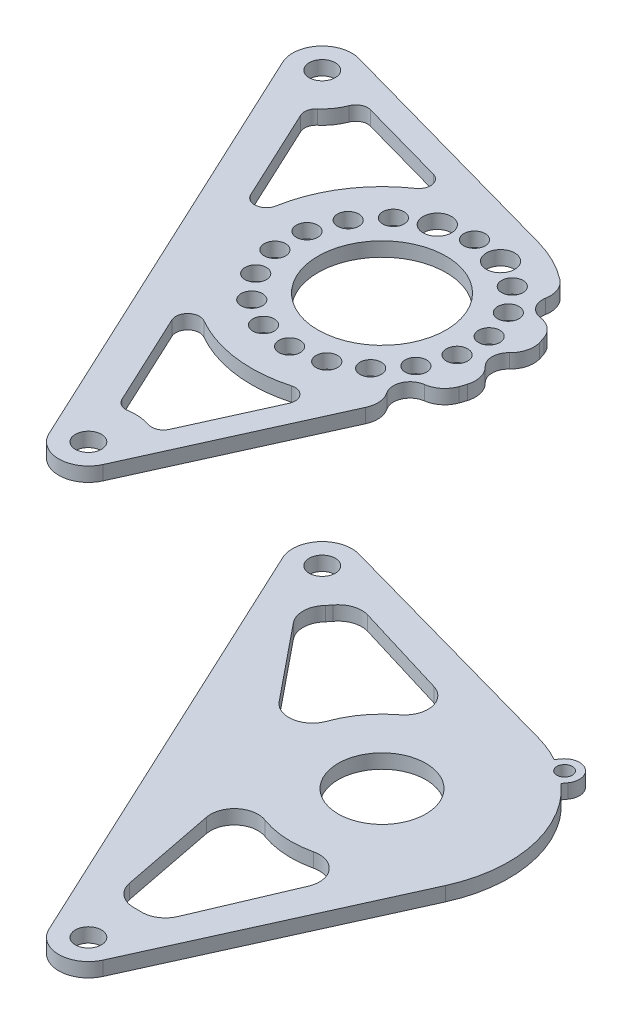
from build123d import *

# Parameters (mm, degrees)
SKETCH1_R            = 27
SKETCH1_R_2          = 5.500000000000008
SKETCH1_R_3          = 5.500000000000017
BOSS_EXTRUDE1_DEPTH  = 6
M8_CLEARANCE_HOLE1_D = 9
SKETCH4_R            = 5.999999999999999
CUT_EXTRUDE1_DEPTH   = 168.21175155495473
BOSS_EXTRUDE3_DEPTH  = 6
SKETCH9_R            = 18.5
SKETCH9_R_2          = 5.500000000000017
SKETCH9_R_3          = 5.500000000000006
BOSS_EXTRUDE2_DEPTH  = 6
SKETCH7_R            = 7.059999999999994
SKETCH7_R_2          = 7.0600000000000005
SKETCH7_R_3          = 7.059999999999993
CUT_EXTRUDE4_DEPTH   = 6
FILLET1_R            = 10
CUT_EXTRUDE5_DEPTH   = 6
FILLET2_R            = 5
CUT_EXTRUDE6_DEPTH   = 6
FILLET3_R            = 10
BOSS_EXTRUDE4_DEPTH  = 6
SKETCH19_R           = 3.2500000000000013
CUT_EXTRUDE7_DEPTH   = 6


with BuildPart() as part:
    # Sketch1 → Boss-Extrude1 (new body)
    with BuildSketch(Plane(origin=(0, 0, 0), x_dir=(1, 0, 0), z_dir=(0, 1, 0))):
        with BuildLine():
            Line((43.10169024537115, -16.069981269188727), (4.121656155384393, -120.61928515182078))
            ThreePointArc((4.121656155384393, -120.61928515182078), (-7.090354785618229, -128.74242219741816), (-18.916285003056604, -121.542288914277))
            Line((-18.916285003056604, -121.542288914277), (-105.34584466052408, 63.502809745719105))
            ThreePointArc((-105.34584466052408, 63.502809745719105), (-103.27710977103428, 77.19276521532294), (-89.85172700954884, 80.57708826585134))
            Line((-89.85172700954884, 80.57708826585134), (15.340419737897069, 43.366709839059006))
            ThreePointArc((15.340419737897069, 43.366709839059006), (41.67793321769229, 19.46663511502645), (43.10169024537115, -16.069981269188727))
        make_face()
        with Locations(Location((0, 0, 0), (0, 0, 270))):
            Circle(SKETCH1_R, mode=Mode.SUBTRACT)
        with Locations(Location((-7.590759672162107, -116.25244241562818, 0), (0, 0, 270))):
            Circle(SKETCH1_R_2, mode=Mode.SUBTRACT)
        with Locations(Location((-94.02031932962956, 68.79265624436792, 0), (0, 0, 270))):
            Circle(SKETCH1_R_3, mode=Mode.SUBTRACT)
    extrude(amount=BOSS_EXTRUDE1_DEPTH)

    # M8 Clearance Hole1 (through all)
    with Locations(Plane(origin=(0, 6, 0), x_dir=(1, 0, 0), z_dir=(0, 1, 0))):
        with Locations((0, 39), (25.068716778, 29.875733282), (33.774990748, 19.5), (38.407502367, 6.772278929), (38.407502367, -6.772278929), (33.774990748, -19.5), (25.068716778, -29.875733282), (13.33878559, -36.648012211), (0, -39), (-13.33878559, -36.648012211), (-25.068716778, -29.875733282), (-33.774990748, -19.5), (-38.407502367, -6.772278929), (-38.407502367, 6.772278929), (-33.774990748, 19.5), (-25.068716778, 29.875733282)):
            Hole(M8_CLEARANCE_HOLE1_D / 2)

    # Sketch4 → Cut-Extrude1 (cut, through all)
    with BuildSketch(Plane(origin=(0, 6, 0), x_dir=(1, 0, 0), z_dir=(0, 1, 0))):
        with Locations(Location((-13.335, 36.64938983121001, 0), (0, 0, 270))):
            Circle(SKETCH4_R)
        with Locations(Location((13.335, 36.64938983121001, 0), (0, 0, 270))):
            Circle(SKETCH4_R)
    extrude(amount=-CUT_EXTRUDE1_DEPTH, mode=Mode.SUBTRACT)

    # Sketch13 → Boss-Extrude3 (add)
    with BuildSketch(Plane.XZ):
        with BuildLine():
            Line((48.74417686435453, 22.051195473636422), (3.798066698014179, 121.40459089077687))
            Line((3.798066698014179, 121.40459089077687), (43.10169024537115, 16.069981269188727))
            ThreePointArc((43.10169024537115, 16.069981269188727), (41.67793321769229, -19.46663511502645), (15.340419737897069, -43.366709839059006))
            Line((15.340419737897069, -43.366709839059006), (-90.66162764448717, -80.83297144639462))
            Line((-90.66162764448717, -80.83297144639462), (14.37520041240948, -51.53254906467429))
            ThreePointArc((14.37520041240948, -51.53254906467429), (48.473248416229154, -22.640543014215424), (48.74417686435453, 22.051195473636422))
        make_face()
    extrude(amount=-BOSS_EXTRUDE3_DEPTH)

    # Sketch7 → Cut-Extrude4 (cut)
    with BuildSketch(Plane(origin=(0, 6, 0), x_dir=(1, 0, 0), z_dir=(0, 1, 0))):
        with Locations((43.28713896759637, 31.44)):
            Circle(SKETCH7_R)
        with Locations((53.5, 0)):
            Circle(SKETCH7_R_2)
        with Locations((43.28713896759637, -31.44)):
            Circle(SKETCH7_R_3)
    extrude(amount=-CUT_EXTRUDE4_DEPTH, mode=Mode.SUBTRACT)

    # Fillet1
    fillet1_edges = [part.edges().sort_by_distance(p)[0] for p in [
        (47.050098611701245, 3, -25.46641358003106),
        (38.77037136127814, 3, -36.866086102386646),
        (53.034171962616824, 3, 7.0446152655477015),
        (53.034171962616824, 3, -7.044615265547705),
        (47.16556143663344, 3, 25.54072554023223),
        (41.41704833354494, 3, 38.24781617116921),
    ]]
    fillet(fillet1_edges, radius=FILLET1_R)

    # Sketch14 → Cut-Extrude5 (cut)
    with BuildSketch(Plane(origin=(0, 6, 0), x_dir=(1, 0, 0), z_dir=(0, 1, 0))):
        with BuildLine():
            Line((-74.23517315376525, 65.86896152711691), (-20.730399437587575, 50.943601552678516))
            ThreePointArc((-20.730399437587575, 50.943601552678516), (-49.25962394873262, 24.46404399173302), (-53.116964372688535, -14.268430040846713))
            Line((-53.116964372688535, -14.268430040846713), (-83.86494519848478, 51.56278752007186))
            ThreePointArc((-83.86494519848478, 51.56278752007186), (-77.42889555879034, 57.62463684715917), (-74.23517315376525, 65.86896152711691))
        make_face()
        with BuildLine():
            Line((-14.285548146168242, -97.40622774826556), (-45.0335289719607, -31.575010187355062))
            ThreePointArc((-45.0335289719607, -31.575010187355062), (-12.85572984750795, -53.47644537633268), (25.76091414072229, -48.5939842226827))
            Line((25.76091414072229, -48.5939842226827), (2.865787751627601, -99.20367073042938))
            ThreePointArc((2.865787751627601, -99.20367073042938), (-5.506195468880833, -96.36137426727582), (-14.285548146168242, -97.40622774826556))
        make_face()
    extrude(amount=-CUT_EXTRUDE5_DEPTH, mode=Mode.SUBTRACT)

    # Fillet2
    fillet2_edges = [part.edges().sort_by_distance(p)[0] for p in [
        (-74.23517315376525, 3, -65.86896152711691),
        (-20.730399437587575, 3, -50.943601552678516),
        (-53.116964372688535, 3, 14.268430040846713),
        (-83.86494519848478, 3, -51.56278752007185),
        (-14.285548146168242, 3, 97.40622774826556),
        (-45.033528971960706, 3, 31.575010187355062),
        (25.76091414072229, 3, 48.5939842226827),
        (2.865787751627601, 3, 99.20367073042938),
    ]]
    fillet(fillet2_edges, radius=FILLET2_R)


with BuildPart() as body_2:
    # Sketch9 → Boss-Extrude2 (new body)
    with BuildSketch(Plane(origin=(0, -175, 0), x_dir=(1, 0, 0), z_dir=(0, 1, 0))):
        with BuildLine():
            Line((-90.66162764448717, 80.83297144639464), (14.375200412409482, 51.53254906467428))
            ThreePointArc((14.375200412409482, 51.53254906467428), (48.47324841622914, 22.640543014215417), (48.74417686435452, -22.051195473636422))
            Line((48.74417686435452, -22.051195473636422), (3.7980666980141717, -121.40459089077687))
            ThreePointArc((3.7980666980141717, -121.40459089077687), (-7.514984070465397, -128.75221273584555), (-18.916285003056604, -121.542288914277))
            Line((-18.916285003056604, -121.542288914277), (-105.34584466052408, 63.502809745719105))
            ThreePointArc((-105.34584466052408, 63.502809745719105), (-103.55715505893005, 76.87342132400846), (-90.66162764448717, 80.83297144639464))
        make_face()
        with Locations(Location((0, 0, 0), (0, 0, 270))):
            Circle(SKETCH9_R, mode=Mode.SUBTRACT)
        with Locations(Location((-94.02031932962956, 68.79265624436792, 0), (0, 0, 270))):
            Circle(SKETCH9_R_2, mode=Mode.SUBTRACT)
        with Locations(Location((-7.590759672162106, -116.25244241562818, 0), (0, 0, 270))):
            Circle(SKETCH9_R_3, mode=Mode.SUBTRACT)
    extrude(amount=-BOSS_EXTRUDE2_DEPTH)

    # Sketch15 → Cut-Extrude6 (cut)
    with BuildSketch(Plane.XZ.offset(181)):
        with BuildLine():
            Line((11.188628918305138, -36.83835749498702), (-74.40509001411698, -62.83507461254312))
            ThreePointArc((-74.40509001411698, -62.83507461254312), (-78.71449045511118, -55.15514905045745), (-85.84840137943056, -49.991864851045776))
            Line((-85.84840137943056, -49.991864851045776), (-37.181875060882554, 9.987901028590548))
            ThreePointArc((-37.181875060882554, 9.987901028590548), (-26.778477049421305, -27.661582870718316), (11.188628918305138, -36.83835749498702))
        make_face()
        with BuildLine():
            Line((35.430691763053375, 15.063733972408766), (0.43018958587372463, 97.38674939893741))
            ThreePointArc((0.43018958587372463, 97.38674939893741), (-8.22505248389858, 95.76225762805294), (-16.763243284449498, 97.91898817529693))
            Line((-16.763243284449498, 97.91898817529693), (-31.523470280374102, 22.10250713114625))
            ThreePointArc((-31.523470280374102, 22.10250713114625), (4.025254876864121, 38.288997416702905), (35.430691763053375, 15.063733972408766))
        make_face()
    extrude(amount=-CUT_EXTRUDE6_DEPTH, mode=Mode.SUBTRACT)

    # Fillet3
    fillet3_edges = [body_2.edges().sort_by_distance(p)[0] for p in [
        (-37.18187506088256, -178, 9.98790102859055),
        (-74.40509001411698, -178, -62.83507461254312),
        (-85.84840137943056, -178, -49.991864851045776),
        (-16.763243284449494, -178, 97.91898817529693),
        (0.4301895858737248, -178, 97.38674939893741),
        (35.430691763053375, -178, 15.06373397240877),
        (-31.523470280374102, -178, 22.10250713114625),
    ]]
    fillet(fillet3_edges, radius=FILLET3_R)
    fillet3_2_edges = [body_2.edges().sort_by_distance(p)[0] for p in [
        (11.188628918305138, -178, -36.83835749498702),
    ]]
    fillet(fillet3_2_edges, radius=FILLET3_R)

    # Sketch17 → Boss-Extrude4 (add)
    with BuildSketch(Plane.XZ.offset(181)):
        with BuildLine():
            Line((37.093470778554746, -41.37797633524996), (35.885699739475456, -39.679548311544714))
            ThreePointArc((35.885699739475456, -39.679548311544714), (31.0045225702602, -43.600109864428376), (25.698758182366007, -46.92359564104476))
            Line((25.698758182366007, -46.92359564104476), (26.9065292214453, -48.62202366475002))
            ThreePointArc((26.9065292214453, -48.62202366475002), (35.622023664750046, -50.093470778554725), (37.093470778554746, -41.37797633524996))
        make_face()
    extrude(amount=-BOSS_EXTRUDE4_DEPTH)

    # Sketch19 → Cut-Extrude7 (cut)
    with BuildSketch(Plane.XZ.offset(181)):
        with Locations(Location((32.000000000000014, -44.99999999999999, 0), (0, 0, 270))):
            Circle(SKETCH19_R)
    extrude(amount=-CUT_EXTRUDE7_DEPTH, mode=Mode.SUBTRACT)


solid = Compound([part.part, body_2.part])
